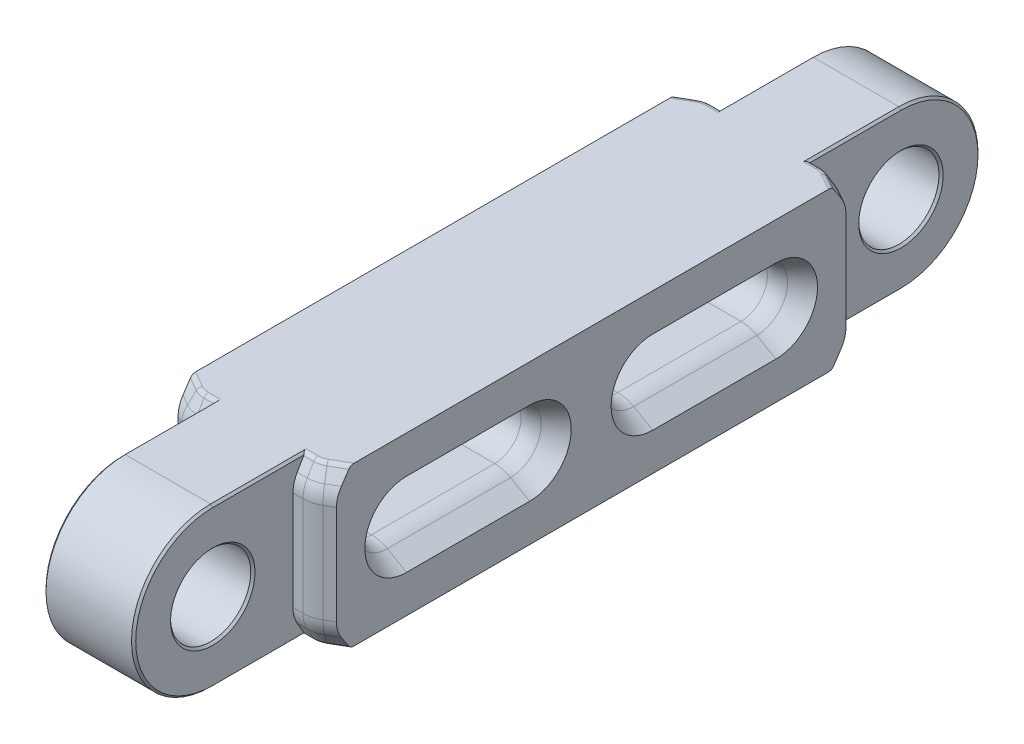
from build123d import *
from OCP.BRepFilletAPI import BRepFilletAPI_MakeChamfer

# Parameters (mm, degrees)
BOSS_EXTRUDE1_DEPTH = 8.5
BOSS_EXTRUDE2_DEPTH = 15
CHAMFER8_SIZE       = 3
CHAMFER8_SIZE2      = 1.732050808
FILLET6_R           = 6
CHAMFER9_SIZE       = 4
CHAMFER9_SIZE2      = 2.309401077
FILLET7_R           = 6
CHAMFER10_SIZE      = 5
CHAMFER10_SIZE2     = 2.886751346
FILLET8_R           = 6
FILLET9_R           = 1
CHAMFER11_SIZE      = 0.4


with BuildPart() as part:
    # Sketch1 → Boss-Extrude1 (new body)
    with BuildSketch(Plane.YZ):
        with BuildLine():
            ThreePointArc((0, -7.6), (-7.6, 0), (0, 7.6))
            Line((0, 7.6), (0, 15))
            ThreePointArc((0, 15), (-10.606601718, 10.606601718), (-15, 0))
            Line((-15, 0), (-15, -65.2))
            Line((-15, -65.2), (0, -65.2))
            Line((0, -65.2), (0, -58.533333333))
            ThreePointArc((0, -58.533333333), (-3.535533906, -57.068867239), (-5, -53.533333333))
            Line((-5, -53.533333333), (-5, -30.2))
            ThreePointArc((-5, -30.2), (-3.535533906, -26.664466094), (0, -25.2))
            Line((0, -25.2), (0, -7.6))
        make_face()
    extrude(amount=BOSS_EXTRUDE1_DEPTH)

    # Sketch1<4> → Boss-Extrude2 (add)
    with BuildSketch(Plane.YZ):
        with BuildLine():
            Line((0, -15.2), (-15, -15.2))
            Line((-15, -15.2), (-15, -65.2))
            Line((-15, -65.2), (0, -65.2))
            Line((0, -65.2), (0, -58.533333333))
            ThreePointArc((0, -58.533333333), (-3.535533906, -57.068867239), (-5, -53.533333333))
            Line((-5, -53.533333333), (-5, -30.2))
            ThreePointArc((-5, -30.2), (-3.535533906, -26.664466094), (0, -25.2))
            Line((0, -25.2), (0, -15.2))
        make_face()
    extrude(amount=BOSS_EXTRUDE2_DEPTH)

    # Chamfer8
    chamfer8_edges = [part.edges().sort_by_distance(p)[0] for p in [
        (15, -7.5, -15.2),
    ]]
    chamfer8_side = [part.faces().sort_by_distance(p)[0] for p in [
        (11.75, -7.5, -15.2),
    ]]
    chamfer(chamfer8_edges, length=CHAMFER8_SIZE, length2=CHAMFER8_SIZE2, reference=chamfer8_side[0])

    # Fillet6
    fillet6_edges = [part.edges().sort_by_distance(p)[0] for p in [
        (12, -7.5, -15.2),
    ]]
    fillet(fillet6_edges, radius=FILLET6_R)

    # Chamfer9: one chamfer whose edges measure the first distance from different faces: ONE call of the kernel's chamfer builder (chamfer() names one face for all edges)
    chamfer9_edges_1 = [part.edges().sort_by_distance(p)[0] for p in [
        (14.196152423, -15, -16.467949192),
    ]]
    chamfer9_side_1 = [part.faces().sort_by_distance(p)[0] for p in [
        (14.196152423, -7.5, -16.467949192),
    ]]
    chamfer9_edges_2 = [part.edges().sort_by_distance(p)[0] for p in [
        (11.945219116, -15, -15.404445042),
    ]]
    chamfer9_side_2 = [part.faces().sort_by_distance(p)[0] for p in [
        (11.945219116, -7.5, -15.404445042),
    ]]
    chamfer9_edges_3 = [part.edges().sort_by_distance(p)[0] for p in [
        (9.446152423, -15, -15.2),
    ]]
    chamfer9_side_3 = [part.faces().sort_by_distance(p)[0] for p in [
        (9.446152423, -7.5, -15.2),
    ]]
    chamfer9 = BRepFilletAPI_MakeChamfer(part.part.solid().wrapped)
    for e in chamfer9_edges_1:
        chamfer9.Add(CHAMFER9_SIZE, CHAMFER9_SIZE2, e.wrapped, chamfer9_side_1[0].wrapped)  # the first distance lies on this face
    for e in chamfer9_edges_2:
        chamfer9.Add(CHAMFER9_SIZE, CHAMFER9_SIZE2, e.wrapped, chamfer9_side_2[0].wrapped)  # the first distance lies on this face
    for e in chamfer9_edges_3:
        chamfer9.Add(CHAMFER9_SIZE, CHAMFER9_SIZE2, e.wrapped, chamfer9_side_3[0].wrapped)  # the first distance lies on this face
    add(Compound.cast(chamfer9.Shape()), mode=Mode.REPLACE)

    # Fillet7
    fillet7_edges = [part.edges().sort_by_distance(p)[0] for p in [
        (14.196152423, -11, -16.467949192),
        (11.945219116, -11, -15.404445042),
        (9.446152423, -11, -15.2),
    ]]
    fillet(fillet7_edges, radius=FILLET7_R)

    # Chamfer10: one chamfer whose edges measure the first distance from different faces: ONE call of the kernel's chamfer builder (chamfer() names one face for all edges)
    chamfer10_edges_1 = [part.edges().sort_by_distance(p)[0] for p in [
        (15, -3.535533906, -57.068867239),
    ]]
    chamfer10_side_1 = [part.faces().sort_by_distance(p)[0] for p in [
        (7.5, -3.535533906, -57.068867239),
    ]]
    chamfer10_edges_2 = [part.edges().sort_by_distance(p)[0] for p in [
        (15, -5, -41.866666667),
    ]]
    chamfer10_side_2 = [part.faces().sort_by_distance(p)[0] for p in [
        (7.5, -5, -41.866666667),
    ]]
    chamfer10_edges_3 = [part.edges().sort_by_distance(p)[0] for p in [
        (15, -3.535533906, -26.664466094),
    ]]
    chamfer10_side_3 = [part.faces().sort_by_distance(p)[0] for p in [
        (7.5, -3.535533906, -26.664466094),
    ]]
    chamfer10 = BRepFilletAPI_MakeChamfer(part.part.solid().wrapped)
    for e in chamfer10_edges_1:
        chamfer10.Add(CHAMFER10_SIZE, CHAMFER10_SIZE2, e.wrapped, chamfer10_side_1[0].wrapped)  # the first distance lies on this face
    for e in chamfer10_edges_2:
        chamfer10.Add(CHAMFER10_SIZE, CHAMFER10_SIZE2, e.wrapped, chamfer10_side_2[0].wrapped)  # the first distance lies on this face
    for e in chamfer10_edges_3:
        chamfer10.Add(CHAMFER10_SIZE, CHAMFER10_SIZE2, e.wrapped, chamfer10_side_3[0].wrapped)  # the first distance lies on this face
    add(Compound.cast(chamfer10.Shape()), mode=Mode.REPLACE)

    # Fillet8
    fillet8_edges = [part.edges().sort_by_distance(p)[0] for p in [
        (10, -3.535533906, -57.068867239),
        (10, -5, -41.866666667),
        (10, -3.535533906, -26.664466094),
    ]]
    fillet(fillet8_edges, radius=FILLET8_R)

    # Fillet9
    fillet9_edges = [part.edges().sort_by_distance(p)[0] for p in [
        (9.446152423, -15, -17.509401077),
        (11.347502135, -15, -17.635155186),
        (13.618802154, -15, -18.801282526),
    ]]
    fillet(fillet9_edges, radius=FILLET9_R)

    # Chamfer11
    chamfer11_edges = [part.edges().sort_by_distance(p)[0] for p in [
        (8.5, -7.6, 0),
        (8.5, -15, -9.043375673),
        (8.5, -10.606601718, 10.606601718),
    ]]
    chamfer(chamfer11_edges, length=CHAMFER11_SIZE)

    # Mirror1: part across plane


with BuildPart() as part_1:
    add(part.part)
    add(part.part.mirror(Plane(origin=(8.5, 0, 0), x_dir=(0, 0, 1), z_dir=(0, 1, 0))))

    # Mirror2: part across plane


with BuildPart() as part_2:
    add(part_1.part)
    add(part_1.part.mirror(Plane(origin=(8.5, 0, -65.2), x_dir=(1, 0, 0), z_dir=(0, 0, 1))))

    # Mirror3: part across plane


with BuildPart() as part_3:
    add(part_2.part)
    add(part_2.part.mirror(Plane(origin=(0, 0, 0), x_dir=(0, 0, 1), z_dir=(1, 0, 0))))


solid = part_3.part
